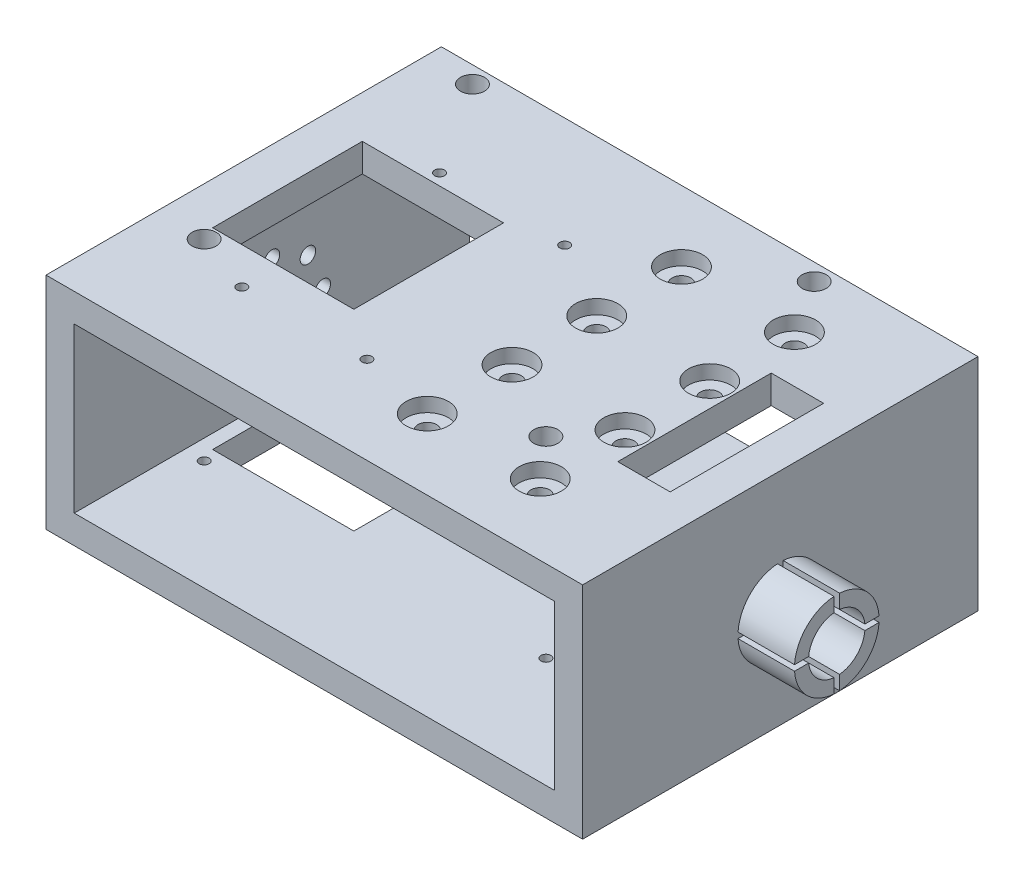
from build123d import *

# Parameters (mm, degrees)
SKETCH1_W                                 = 190
SKETCH1_H                                 = 78
SKETCH1_W_2                               = 170
SKETCH1_H_2                               = 58
BOSS_EXTRUDE1_DEPTH                       = 70
BOSS_EXTRUDE2_START                       = 95
SKETCH2_R                                 = 15
SKETCH2_R_2                               = 10
BOSS_EXTRUDE2_DEPTH                       = 20
SKETCH3_R                                 = 10
CUT_EXTRUDE1_DEPTH                        = 150
SKETCH4_R                                 = 2.75
CUT_EXTRUDE2_DEPTH                        = 150
CUT_EXTRUDE3_DEPTH                        = 208
SKETCH7_R                                 = 3.25
CUT_EXTRUDE4_DEPTH                        = 26
CBORE_START                               = 38
CBORE_FOR_M5_HEX_HEAD_BOLT1_OUTLINE_R     = 7.5
CBORE_FOR_M5_HEX_HEAD_BOLT1_OUTLINE_R_2   = 3.25
CBORE_FOR_M5_HEX_HEAD_BOLT1_DEPTH         = 5
CBORE_START_2                             = 33
CBORE_FOR_M5_HEX_HEAD_BOLT1_2_OUTLINE_R   = 3.3
CBORE_FOR_M5_HEX_HEAD_BOLT1_2_OUTLINE_R_2 = 3.25
CBORE_FOR_M5_HEX_HEAD_BOLT1_2_DEPTH       = 5
CUT_EXTRUDE5_DEPTH                        = 156.592416268
CUT_EXTRUDE5_DEPTH_BACK                   = 156.592416268
SKETCH10_W                                = 50
SKETCH10_H                                = 53
SKETCH10_W_2                              = 18.555485725
SKETCH10_H_2                              = 54.34343807
SKETCH11_R                                = 1.75
SKETCH11_R_2                              = 4.25
CUT_EXTRUDE6_DEPTH                        = 10
SKETCH12_R                                = 1.75
CUT_EXTRUDE7_DEPTH                        = 10


# Read off the part's stored shape, not the designer's step: CBORE for M5 Hex Head Bolt1
with BuildPart() as part:
    # Sketch1 → Boss-Extrude1 (new, symmetric)
    with BuildSketch(Plane.XY):
        with Locations((0, 4)):
            Rectangle(SKETCH1_W, SKETCH1_H)
        with Locations((0, 4)):
            Rectangle(SKETCH1_W_2, SKETCH1_H_2, mode=Mode.SUBTRACT)
    extrude(amount=BOSS_EXTRUDE1_DEPTH, both=True)

    # Sketch2 → Boss-Extrude2 (add)
    with BuildSketch(Plane(origin=(0, 0, 0), x_dir=(0, 0, -1), z_dir=(1, 0, 0)).offset(BOSS_EXTRUDE2_START)):
        with Locations(Location((0, 0, 0), (0, 0, 180))):
            Circle(SKETCH2_R)
        with Locations(Location((0, 0, 0), (0, 0, 180))):
            Circle(SKETCH2_R_2, mode=Mode.SUBTRACT)
    extrude(amount=BOSS_EXTRUDE2_DEPTH)

    # Sketch3 → Cut-Extrude1 (cut)
    with BuildSketch(Plane(origin=(0, 0, 0), x_dir=(0, 0, -1), z_dir=(1, 0, 0))):
        with Locations(Location((0, 0, 0), (0, 0, 180))):
            Circle(SKETCH3_R)
    extrude(amount=CUT_EXTRUDE1_DEPTH, mode=Mode.SUBTRACT)

    # Sketch4 → Cut-Extrude2 (cut)
    with BuildSketch(Plane(origin=(0, 0, 0), x_dir=(0, 0, -1), z_dir=(1, 0, 0))):
        with Locations((0, 18)):
            Circle(SKETCH4_R)
        with Locations((12.727922061, 12.727922061)):
            Circle(SKETCH4_R)
        with Locations((18, 0)):
            Circle(SKETCH4_R)
        with Locations((12.727922061, -12.727922061)):
            Circle(SKETCH4_R)
        with Locations((0, -18)):
            Circle(SKETCH4_R)
        with Locations((-12.727922061, -12.727922061)):
            Circle(SKETCH4_R)
        with Locations((-18, 0)):
            Circle(SKETCH4_R)
        with Locations((-12.727922061, 12.727922061)):
            Circle(SKETCH4_R)
    extrude(amount=-CUT_EXTRUDE2_DEPTH, mode=Mode.SUBTRACT)

    # Sketch5 → Cut-Extrude3 (cut, through all)
    with BuildSketch(Plane(origin=(95, 0, 0), x_dir=(0, 0, -1), z_dir=(1, 0, 0))):
        with BuildLine():
            ThreePointArc((15, 0), (14.991655066, -0.500278319), (14.966629547, -1))
            Line((14.966629547, -1), (20.919422727, -1))
            Line((20.919422727, -1), (20.919422727, 1))
            Line((20.919422727, 1), (14.966629547, 1))
            ThreePointArc((14.966629547, 1), (14.991655066, 0.500278319), (15, 0))
        make_face()
        with BuildLine():
            ThreePointArc((-14.966629547, 1), (-15, 0), (-14.966629547, -1))
            Line((-14.966629547, -1), (-1, -1))
            Line((-1, -1), (-1, 1))
            Line((-1, 1), (-14.966629547, 1))
        make_face()
        with BuildLine():
            Line((1, -1), (-1, -1))
            Line((-1, -1), (-1, -14.966629547))
            ThreePointArc((-1, -14.966629547), (0, -15), (1, -14.966629547))
            Line((1, -14.966629547), (1, -1))
        make_face()
        with BuildLine():
            Line((-1, 14.966629547), (-1, 1))
            Line((-1, 1), (1, 1))
            Line((1, 1), (1, 14.966629547))
            ThreePointArc((1, 14.966629547), (0, 15), (-1, 14.966629547))
        make_face()
        with BuildLine():
            Line((1, 1), (1, -1))
            Line((1, -1), (14.966629547, -1))
            ThreePointArc((14.966629547, -1), (14.991655066, -0.500278319), (15, 0))
            ThreePointArc((15, 0), (14.991655066, 0.500278319), (14.966629547, 1))
            Line((14.966629547, 1), (1, 1))
        make_face()
        with BuildLine():
            ThreePointArc((1, -14.966629547), (0, -15), (-1, -14.966629547))
            Line((-1, -14.966629547), (-1, -18.179329237))
            Line((-1, -18.179329237), (1, -18.179329237))
            Line((1, -18.179329237), (1, -14.966629547))
        make_face()
        with BuildLine():
            Line((-20.919422727, 1), (-20.919422727, -1))
            Line((-20.919422727, -1), (-14.966629547, -1))
            ThreePointArc((-14.966629547, -1), (-15, 0), (-14.966629547, 1))
            Line((-14.966629547, 1), (-20.919422727, 1))
        make_face()
        with BuildLine():
            Line((-1, 18.179329237), (-1, 14.966629547))
            ThreePointArc((-1, 14.966629547), (0, 15), (1, 14.966629547))
            Line((1, 14.966629547), (1, 18.179329237))
            Line((1, 18.179329237), (-1, 18.179329237))
        make_face()
    extrude(amount=CUT_EXTRUDE3_DEPTH, mode=Mode.SUBTRACT)

    # Sketch7 → Cut-Extrude4 (cut)
    with BuildSketch(Plane(origin=(0, 43, 0), x_dir=(1, 0, 0), z_dir=(0, 1, 0))):
        with Locations(Location((15, -45, 0), (0, 0, 270))):
            Circle(SKETCH7_R)
        with Locations(Location((55, -45, 0), (0, 0, 270))):
            Circle(SKETCH7_R)
        with Locations(Location((15, -15, 0), (0, 0, 270))):
            Circle(SKETCH7_R)
        with Locations(Location((55, -15, 0), (0, 0, 270))):
            Circle(SKETCH7_R)
        with Locations(Location((15, 15, 0), (0, 0, 270))):
            Circle(SKETCH7_R)
        with Locations(Location((55, 15, 0), (0, 0, 270))):
            Circle(SKETCH7_R)
        with Locations(Location((15, 45, 0), (0, 0, 270))):
            Circle(SKETCH7_R)
        with Locations(Location((55, 45, 0), (0, 0, 270))):
            Circle(SKETCH7_R)
    extrude(amount=-CUT_EXTRUDE4_DEPTH, mode=Mode.SUBTRACT)

    # CBORE for M5 Hex Head Bolt1 outline → CBORE for M5 Hex Head Bolt1 (cut)
    # profile 1 of 8: a face of its own
    with BuildSketch(Plane(origin=(0, 0, 0), x_dir=(1, 0, 0), z_dir=(0, 1, 0)).offset(CBORE_START)):
        with Locations((15, -15)):
            Circle(CBORE_FOR_M5_HEX_HEAD_BOLT1_OUTLINE_R)
        with Locations((15, -15)):
            Circle(CBORE_FOR_M5_HEX_HEAD_BOLT1_OUTLINE_R_2, mode=Mode.SUBTRACT)
    # profile 2 of 8: a face of its own
    with BuildSketch(Plane(origin=(0, 0, 0), x_dir=(1, 0, 0), z_dir=(0, 1, 0)).offset(CBORE_START)):
        with Locations((15, -45)):
            Circle(CBORE_FOR_M5_HEX_HEAD_BOLT1_OUTLINE_R)
        with Locations((15, -45)):
            Circle(CBORE_FOR_M5_HEX_HEAD_BOLT1_OUTLINE_R_2, mode=Mode.SUBTRACT)
    # profile 3 of 8: a face of its own
    with BuildSketch(Plane(origin=(0, 0, 0), x_dir=(1, 0, 0), z_dir=(0, 1, 0)).offset(CBORE_START)):
        with Locations((55, -45)):
            Circle(CBORE_FOR_M5_HEX_HEAD_BOLT1_OUTLINE_R)
        with Locations((55, -45)):
            Circle(CBORE_FOR_M5_HEX_HEAD_BOLT1_OUTLINE_R_2, mode=Mode.SUBTRACT)
    # profile 4 of 8: a face of its own
    with BuildSketch(Plane(origin=(0, 0, 0), x_dir=(1, 0, 0), z_dir=(0, 1, 0)).offset(CBORE_START)):
        with Locations((55, -15)):
            Circle(CBORE_FOR_M5_HEX_HEAD_BOLT1_OUTLINE_R)
        with Locations((55, -15)):
            Circle(CBORE_FOR_M5_HEX_HEAD_BOLT1_OUTLINE_R_2, mode=Mode.SUBTRACT)
    # profile 5 of 8: a face of its own
    with BuildSketch(Plane(origin=(0, 0, 0), x_dir=(1, 0, 0), z_dir=(0, 1, 0)).offset(CBORE_START)):
        with Locations((15, 15)):
            Circle(CBORE_FOR_M5_HEX_HEAD_BOLT1_OUTLINE_R)
        with Locations((15, 15)):
            Circle(CBORE_FOR_M5_HEX_HEAD_BOLT1_OUTLINE_R_2, mode=Mode.SUBTRACT)
    # profile 6 of 8: a face of its own
    with BuildSketch(Plane(origin=(0, 0, 0), x_dir=(1, 0, 0), z_dir=(0, 1, 0)).offset(CBORE_START)):
        with Locations((55, 15)):
            Circle(CBORE_FOR_M5_HEX_HEAD_BOLT1_OUTLINE_R)
        with Locations((55, 15)):
            Circle(CBORE_FOR_M5_HEX_HEAD_BOLT1_OUTLINE_R_2, mode=Mode.SUBTRACT)
    # profile 7 of 8: a face of its own
    with BuildSketch(Plane(origin=(0, 0, 0), x_dir=(1, 0, 0), z_dir=(0, 1, 0)).offset(CBORE_START)):
        with Locations((55, 45)):
            Circle(CBORE_FOR_M5_HEX_HEAD_BOLT1_OUTLINE_R)
        with Locations((55, 45)):
            Circle(CBORE_FOR_M5_HEX_HEAD_BOLT1_OUTLINE_R_2, mode=Mode.SUBTRACT)
    # profile 8 of 8: a face of its own
    with BuildSketch(Plane(origin=(0, 0, 0), x_dir=(1, 0, 0), z_dir=(0, 1, 0)).offset(CBORE_START)):
        with Locations((15, 45)):
            Circle(CBORE_FOR_M5_HEX_HEAD_BOLT1_OUTLINE_R)
        with Locations((15, 45)):
            Circle(CBORE_FOR_M5_HEX_HEAD_BOLT1_OUTLINE_R_2, mode=Mode.SUBTRACT)
    extrude(amount=CBORE_FOR_M5_HEX_HEAD_BOLT1_DEPTH, mode=Mode.SUBTRACT)

    # CBORE for M5 Hex Head Bolt1 2 outline → CBORE for M5 Hex Head Bolt1 2 (cut)
    # profile 1 of 8: a face of its own
    with BuildSketch(Plane(origin=(0, 0, 0), x_dir=(1, 0, 0), z_dir=(0, 1, 0)).offset(CBORE_START_2)):
        with Locations((15, -15)):
            Circle(CBORE_FOR_M5_HEX_HEAD_BOLT1_2_OUTLINE_R)
        with Locations((15, -15)):
            Circle(CBORE_FOR_M5_HEX_HEAD_BOLT1_2_OUTLINE_R_2, mode=Mode.SUBTRACT)
    # profile 2 of 8: a face of its own
    with BuildSketch(Plane(origin=(0, 0, 0), x_dir=(1, 0, 0), z_dir=(0, 1, 0)).offset(CBORE_START_2)):
        with Locations((15, -45)):
            Circle(CBORE_FOR_M5_HEX_HEAD_BOLT1_2_OUTLINE_R)
        with Locations((15, -45)):
            Circle(CBORE_FOR_M5_HEX_HEAD_BOLT1_2_OUTLINE_R_2, mode=Mode.SUBTRACT)
    # profile 3 of 8: a face of its own
    with BuildSketch(Plane(origin=(0, 0, 0), x_dir=(1, 0, 0), z_dir=(0, 1, 0)).offset(CBORE_START_2)):
        with Locations((55, -45)):
            Circle(CBORE_FOR_M5_HEX_HEAD_BOLT1_2_OUTLINE_R)
        with Locations((55, -45)):
            Circle(CBORE_FOR_M5_HEX_HEAD_BOLT1_2_OUTLINE_R_2, mode=Mode.SUBTRACT)
    # profile 4 of 8: a face of its own
    with BuildSketch(Plane(origin=(0, 0, 0), x_dir=(1, 0, 0), z_dir=(0, 1, 0)).offset(CBORE_START_2)):
        with Locations((55, -15)):
            Circle(CBORE_FOR_M5_HEX_HEAD_BOLT1_2_OUTLINE_R)
        with Locations((55, -15)):
            Circle(CBORE_FOR_M5_HEX_HEAD_BOLT1_2_OUTLINE_R_2, mode=Mode.SUBTRACT)
    # profile 5 of 8: a face of its own
    with BuildSketch(Plane(origin=(0, 0, 0), x_dir=(1, 0, 0), z_dir=(0, 1, 0)).offset(CBORE_START_2)):
        with Locations((15, 15)):
            Circle(CBORE_FOR_M5_HEX_HEAD_BOLT1_2_OUTLINE_R)
        with Locations((15, 15)):
            Circle(CBORE_FOR_M5_HEX_HEAD_BOLT1_2_OUTLINE_R_2, mode=Mode.SUBTRACT)
    # profile 6 of 8: a face of its own
    with BuildSketch(Plane(origin=(0, 0, 0), x_dir=(1, 0, 0), z_dir=(0, 1, 0)).offset(CBORE_START_2)):
        with Locations((55, 15)):
            Circle(CBORE_FOR_M5_HEX_HEAD_BOLT1_2_OUTLINE_R)
        with Locations((55, 15)):
            Circle(CBORE_FOR_M5_HEX_HEAD_BOLT1_2_OUTLINE_R_2, mode=Mode.SUBTRACT)
    # profile 7 of 8: a face of its own
    with BuildSketch(Plane(origin=(0, 0, 0), x_dir=(1, 0, 0), z_dir=(0, 1, 0)).offset(CBORE_START_2)):
        with Locations((55, 45)):
            Circle(CBORE_FOR_M5_HEX_HEAD_BOLT1_2_OUTLINE_R)
        with Locations((55, 45)):
            Circle(CBORE_FOR_M5_HEX_HEAD_BOLT1_2_OUTLINE_R_2, mode=Mode.SUBTRACT)
    # profile 8 of 8: a face of its own
    with BuildSketch(Plane(origin=(0, 0, 0), x_dir=(1, 0, 0), z_dir=(0, 1, 0)).offset(CBORE_START_2)):
        with Locations((15, 45)):
            Circle(CBORE_FOR_M5_HEX_HEAD_BOLT1_2_OUTLINE_R)
        with Locations((15, 45)):
            Circle(CBORE_FOR_M5_HEX_HEAD_BOLT1_2_OUTLINE_R_2, mode=Mode.SUBTRACT)
    extrude(amount=CBORE_FOR_M5_HEX_HEAD_BOLT1_2_DEPTH, mode=Mode.SUBTRACT)

    # Sketch10 → Cut-Extrude5 (cut, two sides: drawn at the far end of the back side and taken through both)
    with BuildSketch(Plane(origin=(0, 43, 0), x_dir=(1, 0, 0), z_dir=(0, 1, 0)).offset(-CUT_EXTRUDE5_DEPTH_BACK)):
        with Locations((-55, 0.5)):
            Rectangle(SKETCH10_W, SKETCH10_H)
        with Locations((72.722257138, 1.171719035)):
            Rectangle(SKETCH10_W_2, SKETCH10_H_2)
    extrude(amount=CUT_EXTRUDE5_DEPTH + CUT_EXTRUDE5_DEPTH_BACK, mode=Mode.SUBTRACT)

    # Sketch11 → Cut-Extrude6 (cut)
    with BuildSketch(Plane(origin=(-16, 43, 1.161504527), x_dir=(0.6870356995717798, 0, -0.7266236629190624), z_dir=(0, 1, 0))):
        with Locations(Location((-55.422347368, 3.54085469, 0), (0, 0, 223.395914439))):
            Circle(SKETCH11_R)
        with Locations(Location((-24.986665877, -28.648573578, 0), (0, 0, 223.395914439))):
            Circle(SKETCH11_R)
        with Locations(Location((25.876990528, 19.443925392, 0), (0, 0, 223.395914439))):
            Circle(SKETCH11_R)
        with Locations(Location((-4.558690963, 51.63335366, 0), (0, 0, 223.395914439))):
            Circle(SKETCH11_R)
        with Locations(Location((4.751677727, 89.818946949, 0), (0, 0, 223.395914439))):
            Circle(SKETCH11_R_2)
        with Locations(Location((87.882997375, 1.897483736, 0), (0, 0, 223.395914439))):
            Circle(SKETCH11_R_2)
        with Locations(Location((18.853749398, -63.370907724, 0), (0, 0, 223.395914439))):
            Circle(SKETCH11_R_2)
        with Locations(Location((-64.27757025, 24.550555489, 0), (0, 0, 223.395914439))):
            Circle(SKETCH11_R_2)
    extrude(amount=-CUT_EXTRUDE6_DEPTH, mode=Mode.SUBTRACT)

    # Sketch12 → Cut-Extrude7 (cut)
    with BuildSketch(Plane(origin=(-16, -25, 1.161504527), x_dir=(0.6870356995717798, 0, -0.7266236629190624), z_dir=(0, 1, 0))):
        with Locations(Location((18.853749398, -63.370907724, 0), (0, 0, 223.395914439))):
            Circle(SKETCH12_R)
        with Locations(Location((-64.27757025, 24.550555489, 0), (0, 0, 223.395914439))):
            Circle(SKETCH12_R)
        with Locations(Location((4.751677727, 89.818946949, 0), (0, 0, 223.395914439))):
            Circle(SKETCH12_R)
        with Locations(Location((87.882997375, 1.897483736, 0), (0, 0, 223.395914439))):
            Circle(SKETCH12_R)
    extrude(amount=-CUT_EXTRUDE7_DEPTH, mode=Mode.SUBTRACT)


solid = part.part
